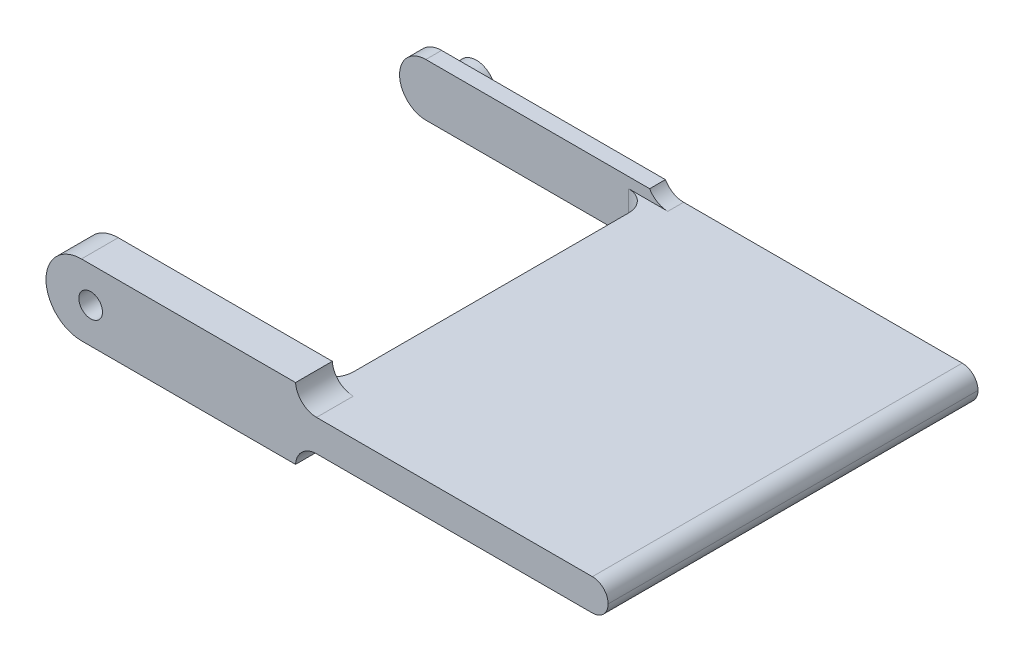
from build123d import *

# Parameters (mm, degrees)
BOSS_EXTRUDE10_DEPTH = 2
BOSS_EXTRUDE15_DEPTH = 1.5
BOSS_EXTRUDE17_START = 2
SKETCH1_17_W         = 29.75
SKETCH1_17_H         = 3
BOSS_EXTRUDE17_DEPTH = 35.2
SKETCH2_W            = 23.8
SKETCH2_H            = 5
BOSS_EXTRUDE18_DEPTH = 1.5
FILLET1_R            = 2
FILLET3_R            = 2
FILLET2_R            = 3.375
FILLET5_R            = 2.5
SKETCH4_R            = 1.85
BOSS_EXTRUDE19_DEPTH = 1.5
FILLET4_R            = 1.5


# Some blends are built 0.0001 mm under size
with BuildPart() as part:
    # Sketch1 → Boss-Extrude10 (new body)
    # profile 1 of 6: a face of its own
    with BuildSketch(Plane.XY.offset(33.2)):
        Polygon((-4.25, 3.375), (-4.25, -3.375), (19.5, -3.375), (19.5, -1.5), (19.5, 1.5), (19.5, 3.375), align=None)
        with BuildLine():
            ThreePointArc((2.515308132, -1.635), (-2.636759375, -1.430908802), (0, 3))
            ThreePointArc((0, 3), (1.430908802, 2.636759375), (2.515308132, 1.635))
            Line((2.515308132, 1.635), (12.065, 1.635))
            ThreePointArc((12.065, 1.635), (13.7, 0), (12.065, -1.635))
            Line((12.065, -1.635), (2.515308132, -1.635))
        make_face(mode=Mode.SUBTRACT)
    # profile 2 of 6: a face of its own
    with BuildSketch(Plane.XY.offset(33.2)):
        with BuildLine():
            Line((12.065, 1.635), (2.515308132, 1.635))
            ThreePointArc((2.515308132, 1.635), (2.876275751, 0.852665117), (3, 0))
            ThreePointArc((3, 0), (2.876275751, -0.852665117), (2.515308132, -1.635))
            Line((2.515308132, -1.635), (12.065, -1.635))
            Line((12.065, -1.635), (12.065, 1.635))
        make_face()
    # profile 3 of 6: a face of its own
    with BuildSketch(Plane.XY.offset(33.2)):
        with BuildLine():
            ThreePointArc((12.065, 1.635), (13.7, 0), (12.065, -1.635))
            Line((12.065, -1.635), (12.065, 1.635))
        make_face()
    # profile 4 of 6: a face of its own
    with BuildSketch(Plane.XY.offset(33.2)):
        with BuildLine():
            Line((0, 1.125), (0, 1.635))
            Line((0, 1.635), (0, 3))
            ThreePointArc((0, 3), (-2.636759375, -1.430908802), (2.515308132, -1.635))
            Line((2.515308132, -1.635), (0, -1.635))
            Line((0, -1.635), (0, -1.125))
            ThreePointArc((0, -1.125), (-1.125, 0), (0, 1.125))
        make_face()
    # profile 5 of 6: a face of its own
    with BuildSketch(Plane.XY.offset(33.2)):
        with BuildLine():
            Line((2.515308132, 1.635), (0, 1.635))
            Line((0, 1.635), (0, 1.125))
            ThreePointArc((0, 1.125), (0.795495129, 0.795495129), (1.125, 0))
            ThreePointArc((1.125, 0), (0.795495129, -0.795495129), (0, -1.125))
            Line((0, -1.125), (0, -1.635))
            Line((0, -1.635), (2.515308132, -1.635))
            ThreePointArc((2.515308132, -1.635), (2.876275751, -0.852665117), (3, 0))
            ThreePointArc((3, 0), (2.876275751, 0.852665117), (2.515308132, 1.635))
        make_face()
    # profile 6 of 6: a face of its own
    with BuildSketch(Plane.XY.offset(33.2)):
        with BuildLine():
            Line((0, 3), (0, 1.635))
            Line((0, 1.635), (2.515308132, 1.635))
            ThreePointArc((2.515308132, 1.635), (1.430908802, 2.636759375), (0, 3))
        make_face()
    extrude(amount=BOSS_EXTRUDE10_DEPTH)

    # Sketch1<16> → Boss-Extrude15 (add)
    with BuildSketch(Plane.XY.offset(33.2)):
        Polygon((-4.25, 3.375), (-4.25, -3.375), (19.5, -3.375), (19.5, -1.5), (19.5, 1.5), (19.5, 3.375), align=None)
        with BuildLine():
            ThreePointArc((12.065, 1.635), (13.7, 0), (12.065, -1.635))
            Line((12.065, -1.635), (2.515308132, -1.635))
            ThreePointArc((2.515308132, -1.635), (-3, 0), (2.515308132, 1.635))
            Line((2.515308132, 1.635), (12.065, 1.635))
        make_face(mode=Mode.SUBTRACT)
    extrude(amount=-BOSS_EXTRUDE15_DEPTH)

    # Sketch1<17> → Boss-Extrude17 (add)
    with BuildSketch(Plane.XY.offset(33.2).offset(BOSS_EXTRUDE17_START)):
        with Locations((34.375, 0)):
            Rectangle(SKETCH1_17_W, SKETCH1_17_H)
    extrude(amount=-BOSS_EXTRUDE17_DEPTH)

    # Sketch2 → Boss-Extrude18 (add)
    with BuildSketch(Plane(origin=(0, 0, 0), x_dir=(-1, 0, 0), z_dir=(0, 0, -1))):
        with Locations((-7.6, 0)):
            Rectangle(SKETCH2_W, SKETCH2_H)
    extrude(amount=-BOSS_EXTRUDE18_DEPTH)

    # Fillet1
    # the kernel refuses this fillet: 2 mm, written as the material it adds along each edge
    with BuildSketch(Plane(origin=(19.5, 1.5, 1.5), x_dir=(1, 0, 0), z_dir=(0, 0, -1))) as fillet1_piece_1:
        with BuildLine():
            CenterArc((1.732050808, -2), FILLET1_R, 90, 60)
            Line((0, -1), (0, 0))
            Line((0, 0), (1.732050808, 0))
        make_face()
    extrude(amount=1.5)
    with BuildSketch(Plane(origin=(19.5, -1.5, 1.5), x_dir=(1, 0, 0), z_dir=(0, 0, -1))) as fillet1_piece_2:
        with BuildLine():
            CenterArc((1.732050808, 2), FILLET1_R, 210, 60)
            Line((0, 1), (0, 0))
            Line((0, 0), (1.732050808, 0))
        make_face()
    extrude(amount=1.5)
    with BuildSketch(Plane(origin=(19.5, -1.5, 35.2), x_dir=(0, -1, 0), z_dir=(0, 0, -1))) as fillet1_piece_3:
        with BuildLine():
            CenterArc((2, -1.996089928), FILLET1_R, 93.583321698, 86.416678302)
            Line((0, -1.996089928), (0, 0))
            Line((0, 0), (1.875, 0))
        make_face()
    extrude(amount=3.5)
    with BuildSketch(Plane(origin=(19.5, 1.5, 35.2), x_dir=(0, 1, 0), z_dir=(0, 0, -1))) as fillet1_piece_4:
        with BuildLine():
            CenterArc((2, 1.996089928), FILLET1_R, 180, 86.416678302)
            Line((0, 1.996089928), (0, 0))
            Line((0, 0), (1.875, 0))
        make_face()
    extrude(amount=3.5)

    # Fillet3
    fillet3_edges = [part.edges().sort_by_distance(p)[0] for p in [
        (19.5, 0, 31.7),
        (19.5, 0, 1.5),
    ]]
    fillet(fillet3_edges, radius=FILLET3_R)

    # Fillet2
    fillet2_edges = [part.edges().sort_by_distance(p)[0] for p in [
        (-4.25, 3.375, 33.45),
        (-4.25, -3.375, 33.45),
    ]]
    fillet(fillet2_edges, radius=FILLET2_R - 0.0001)  # a hair under: the kernel refuses the full size

    # Fillet5
    fillet5_edges = [part.edges().sort_by_distance(p)[0] for p in [
        (-4.3, -2.5, 0.75),
        (-4.3, 2.5, 0.75),
    ]]
    fillet(fillet5_edges, radius=FILLET5_R - 0.0001)  # a hair under: the kernel refuses the full size

    # Sketch4 → Boss-Extrude19 (add)
    with BuildSketch(Plane(origin=(0, 0, 0), x_dir=(-1, 0, 0), z_dir=(0, 0, -1))):
        with Locations(Location((0, 0, 0), (0, 0, 180))):
            Circle(SKETCH4_R)
    extrude(amount=BOSS_EXTRUDE19_DEPTH)

    # Fillet4
    fillet4_edges = [part.edges().sort_by_distance(p)[0] for p in [
        (49.25, 1.5, 17.6),
        (49.25, -1.5, 17.6),
    ]]
    fillet(fillet4_edges, radius=FILLET4_R - 0.0001)  # a hair under: the kernel refuses the full size


solid = part.part
